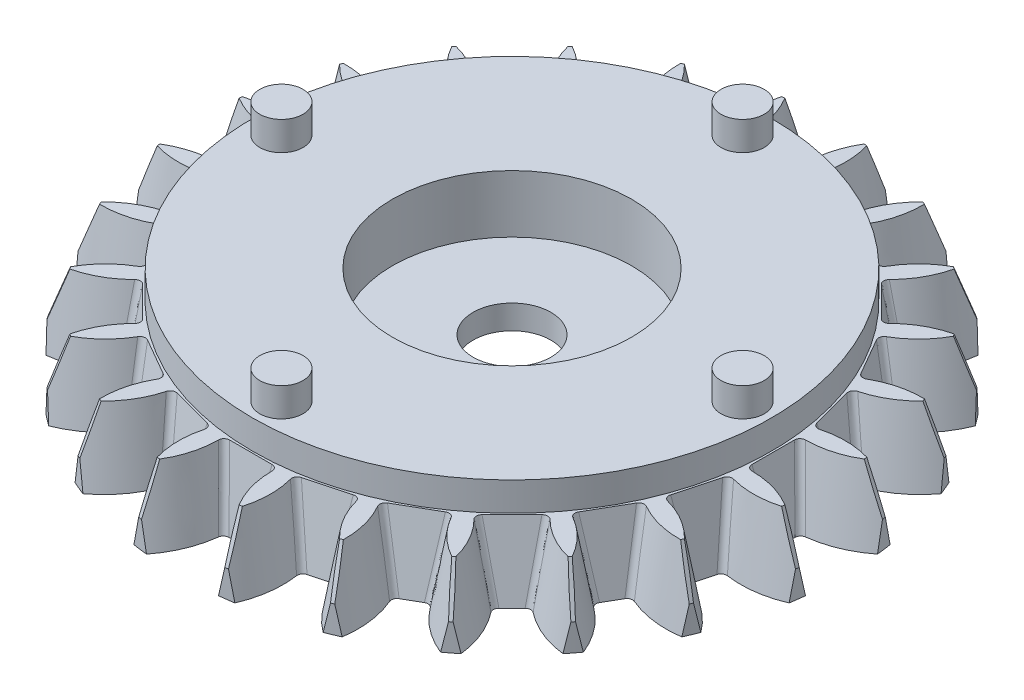
from build123d import *

# Parameters (mm, degrees)
SKETCH1_R                 = 11.5
BOSS_EXTRUDE1_DEPTH       = 2.5
SKETCH2_R                 = 9
BOSS_EXTRUDE2_DEPTH       = 1
CUT_EXTRUDE2_DEPTH        = 2.5
CUT_EXTRUDE2_DRAFT        = 10
FILLET1_R                 = 0.2
CIRPATTERN1_COPY_1_DEPTH  = 2.5
CIRPATTERN1_COPY_1_DRAFT  = 10
CIRPATTERN1_COPY_2_DEPTH  = 2.5
CIRPATTERN1_COPY_2_DRAFT  = 10
CIRPATTERN1_COPY_3_DEPTH  = 2.5
CIRPATTERN1_COPY_3_DRAFT  = 10
CIRPATTERN1_COPY_4_DEPTH  = 2.5
CIRPATTERN1_COPY_4_DRAFT  = 10
CIRPATTERN1_COPY_5_DEPTH  = 2.5
CIRPATTERN1_COPY_5_DRAFT  = 10
CIRPATTERN1_COPY_6_DEPTH  = 2.5
CIRPATTERN1_COPY_6_DRAFT  = 10
CIRPATTERN1_COPY_7_DEPTH  = 2.5
CIRPATTERN1_COPY_7_DRAFT  = 10
CIRPATTERN1_COPY_8_DEPTH  = 2.5
CIRPATTERN1_COPY_8_DRAFT  = 10
CIRPATTERN1_COPY_9_DEPTH  = 2.5
CIRPATTERN1_COPY_9_DRAFT  = 10
CIRPATTERN1_COPY_10_DEPTH = 2.5
CIRPATTERN1_COPY_10_DRAFT = 10
CIRPATTERN1_COPY_11_DEPTH = 2.5
CIRPATTERN1_COPY_11_DRAFT = 10
CIRPATTERN1_COPY_12_DEPTH = 2.5
CIRPATTERN1_COPY_12_DRAFT = 10
CIRPATTERN1_COPY_13_DEPTH = 2.5
CIRPATTERN1_COPY_13_DRAFT = 10
CIRPATTERN1_COPY_14_DEPTH = 2.5
CIRPATTERN1_COPY_14_DRAFT = 10
CIRPATTERN1_COPY_15_DEPTH = 2.5
CIRPATTERN1_COPY_15_DRAFT = 10
CIRPATTERN1_COPY_16_DEPTH = 2.5
CIRPATTERN1_COPY_16_DRAFT = 10
CIRPATTERN1_COPY_17_DEPTH = 2.5
CIRPATTERN1_COPY_17_DRAFT = 10
CIRPATTERN1_COPY_18_DEPTH = 2.5
CIRPATTERN1_COPY_18_DRAFT = 10
CIRPATTERN1_COPY_19_DEPTH = 2.5
CIRPATTERN1_COPY_19_DRAFT = 10
CIRPATTERN1_COPY_20_DEPTH = 2.5
CIRPATTERN1_COPY_20_DRAFT = 10
CIRPATTERN1_COPY_21_DEPTH = 2.5
CIRPATTERN1_COPY_21_DRAFT = 10
CIRPATTERN1_COPY_22_DEPTH = 2.5
CIRPATTERN1_COPY_22_DRAFT = 10
CIRPATTERN1_COPY_23_DEPTH = 2.5
CIRPATTERN1_COPY_23_DRAFT = 10
FILLET1_OF_CIRPATTERN1_R  = 0.2
SKETCH5_R                 = 4.15
CUT_EXTRUDE3_DEPTH        = 2
SKETCH13_R                = 0.75
BOSS_EXTRUDE3_DEPTH       = 1


with BuildPart() as part:
    # Sketch1 → Boss-Extrude1 (new body)
    with BuildSketch(Plane(origin=(0, 0, 0), x_dir=(1, 0, 0), z_dir=(0, 1, 0))):
        with Locations(Location((0, 0, 0), (0, 0, 270))):
            Circle(SKETCH1_R)
    extrude(amount=BOSS_EXTRUDE1_DEPTH)

    # Sketch2 → Boss-Extrude2 (add)
    with BuildSketch(Plane(origin=(0, 2.5, 0), x_dir=(1, 0, 0), z_dir=(0, 1, 0))):
        with Locations(Location((0, 0, 0), (0, 0, 270))):
            Circle(SKETCH2_R)
    extrude(amount=BOSS_EXTRUDE2_DEPTH)


with BuildPart() as cut_extrude2_tool:
    # Sketch4 → Cut-Extrude2 (with draft: the straight prism first)
    with BuildSketch(Plane.XZ):
        with BuildLine():
            Line((-0.5, 9.5), (0.5, 9.5))
            ThreePointArc((0.5, 9.5), (0.728740403, 10.522713492), (1.25, 11.431863365))
            ThreePointArc((1.25, 11.431863365), (0, 11.5), (-1.25, 11.431863365))
            ThreePointArc((-1.25, 11.431863365), (-0.728740403, 10.522713492), (-0.5, 9.5))
        make_face()
    extrude(amount=-CUT_EXTRUDE2_DEPTH)
    # Cut-Extrude2: the draft: its side faces are tilted about the plane it starts from
    cut_extrude2_sides = [cut_extrude2_tool.faces().sort_by_distance(p)[0] for p in [
        (-0.728740403, 1.25, 10.522713492),
        (0, 1.25, 9.5),
        (0.728740403, 1.25, 10.522713492),
        (0, 1.25, 11.5),
    ]]
    draft(cut_extrude2_sides, Plane.XZ, CUT_EXTRUDE2_DRAFT)


with BuildPart() as part_1:
    add(part.part)

    # Cut-Extrude2: cut by cut_extrude2_tool
    add(cut_extrude2_tool.part, mode=Mode.SUBTRACT)

    # Fillet1
    fillet1_edges = [part_1.edges().sort_by_distance(p)[0] for p in [
        (-0.712192573, 1.251214505, 9.279377124),
        (0.712192573, 1.251214505, 9.279377124),
    ]]
    fillet(fillet1_edges, radius=FILLET1_R)


with BuildPart() as cirpattern1_copy_1_tool:
    # CirPattern1 copy 1 sketch → CirPattern1 copy 1 (with draft: the straight prism first)
    with BuildSketch(Plane(origin=(0, 0, 0), x_dir=(0.9659258262890683, 0, 0.25881904510252074), z_dir=(0, -1, 0))):
        with BuildLine():
            Line((-0.5, 9.5), (0.5, 9.5))
            ThreePointArc((0.5, 9.5), (0.728740403, 10.522713492), (1.25, 11.431863365))
            ThreePointArc((1.25, 11.431863365), (0, 11.5), (-1.25, 11.431863365))
            ThreePointArc((-1.25, 11.431863365), (-0.728740403, 10.522713492), (-0.5, 9.5))
        make_face()
    extrude(amount=-CIRPATTERN1_COPY_1_DEPTH)
    # CirPattern1 copy 1: the draft: its side faces are tilted about the plane it starts from
    cirpattern1_copy_1_sides = [cirpattern1_copy_1_tool.faces().sort_by_distance(p)[0] for p in [
        (-3.427387834, 1.25, 9.975548829),
        (-2.458780928, 1.25, 9.17629535),
        (-2.019569482, 1.25, 10.35277262),
        (-2.976419019, 1.25, 11.108147002),
    ]]
    draft(cirpattern1_copy_1_sides, Plane(origin=(0, 0, 0), x_dir=(0.9659258262890683, 0, 0.25881904510252074), z_dir=(0, -1, 0)), CIRPATTERN1_COPY_1_DRAFT)


with BuildPart() as part_2:
    add(part_1.part)

    # CirPattern1 copy 1: cut by cirpattern1_copy_1_tool
    add(cirpattern1_copy_1_tool.part, mode=Mode.SUBTRACT)


with BuildPart() as cirpattern1_copy_2_tool:
    # CirPattern1 copy 2 sketch → CirPattern1 copy 2 (with draft: the straight prism first)
    with BuildSketch(Plane(origin=(0, 0, 0), x_dir=(0.8660254037844387, 0, 0.49999999999999994), z_dir=(0, -1, 0))):
        with BuildLine():
            Line((-0.5, 9.5), (0.5, 9.5))
            ThreePointArc((0.5, 9.5), (0.728740403, 10.522713492), (1.25, 11.431863365))
            ThreePointArc((1.25, 11.431863365), (0, 11.5), (-1.25, 11.431863365))
            ThreePointArc((-1.25, 11.431863365), (-0.728740403, 10.522713492), (-0.5, 9.5))
        make_face()
    extrude(amount=-CIRPATTERN1_COPY_2_DEPTH)
    # CirPattern1 copy 2: the draft: its side faces are tilted about the plane it starts from
    cirpattern1_copy_2_sides = [cirpattern1_copy_2_tool.faces().sort_by_distance(p)[0] for p in [
        (-5.892464448, 1.25, 8.748566999),
        (-4.75, 1.25, 8.227241336),
        (-4.630249044, 1.25, 9.477307402),
        (-5.75, 1.25, 9.959292144),
    ]]
    draft(cirpattern1_copy_2_sides, Plane(origin=(0, 0, 0), x_dir=(0.8660254037844387, 0, 0.49999999999999994), z_dir=(0, -1, 0)), CIRPATTERN1_COPY_2_DRAFT)


with BuildPart() as part_3:
    add(part_2.part)

    # CirPattern1 copy 2: cut by cirpattern1_copy_2_tool
    add(cirpattern1_copy_2_tool.part, mode=Mode.SUBTRACT)


with BuildPart() as cirpattern1_copy_3_tool:
    # CirPattern1 copy 3 sketch → CirPattern1 copy 3 (with draft: the straight prism first)
    with BuildSketch(Plane(origin=(0, 0, 0), x_dir=(0.7071067811865476, 0, 0.7071067811865475), z_dir=(0, -1, 0))):
        with BuildLine():
            Line((-0.5, 9.5), (0.5, 9.5))
            ThreePointArc((0.5, 9.5), (0.728740403, 10.522713492), (1.25, 11.431863365))
            ThreePointArc((1.25, 11.431863365), (0, 11.5), (-1.25, 11.431863365))
            ThreePointArc((-1.25, 11.431863365), (-0.728740403, 10.522713492), (-0.5, 9.5))
        make_face()
    extrude(amount=-CIRPATTERN1_COPY_3_DEPTH)
    # CirPattern1 copy 3: the draft: its side faces are tilted about the plane it starts from
    cirpattern1_copy_3_sides = [cirpattern1_copy_3_tool.faces().sort_by_distance(p)[0] for p in [
        (-7.955979347, 1.25, 6.925384786),
        (-6.717514421, 1.25, 6.717514421),
        (-6.925384786, 1.25, 7.955979347),
        (-8.131727984, 1.25, 8.131727984),
    ]]
    draft(cirpattern1_copy_3_sides, Plane(origin=(0, 0, 0), x_dir=(0.7071067811865476, 0, 0.7071067811865475), z_dir=(0, -1, 0)), CIRPATTERN1_COPY_3_DRAFT)


with BuildPart() as part_4:
    add(part_3.part)

    # CirPattern1 copy 3: cut by cirpattern1_copy_3_tool
    add(cirpattern1_copy_3_tool.part, mode=Mode.SUBTRACT)


with BuildPart() as cirpattern1_copy_4_tool:
    # CirPattern1 copy 4 sketch → CirPattern1 copy 4 (with draft: the straight prism first)
    with BuildSketch(Plane(origin=(0, 0, 0), x_dir=(0.5000000000000001, 0, 0.8660254037844386), z_dir=(0, -1, 0))):
        with BuildLine():
            Line((-0.5, 9.5), (0.5, 9.5))
            ThreePointArc((0.5, 9.5), (0.728740403, 10.522713492), (1.25, 11.431863365))
            ThreePointArc((1.25, 11.431863365), (0, 11.5), (-1.25, 11.431863365))
            ThreePointArc((-1.25, 11.431863365), (-0.728740403, 10.522713492), (-0.5, 9.5))
        make_face()
    extrude(amount=-CIRPATTERN1_COPY_4_DEPTH)
    # CirPattern1 copy 4: the draft: its side faces are tilted about the plane it starts from
    cirpattern1_copy_4_sides = [cirpattern1_copy_4_tool.faces().sort_by_distance(p)[0] for p in [
        (-9.477307402, 1.25, 4.630249044),
        (-8.227241336, 1.25, 4.75),
        (-8.748566999, 1.25, 5.892464448),
        (-9.959292144, 1.25, 5.75),
    ]]
    draft(cirpattern1_copy_4_sides, Plane(origin=(0, 0, 0), x_dir=(0.5000000000000001, 0, 0.8660254037844386), z_dir=(0, -1, 0)), CIRPATTERN1_COPY_4_DRAFT)


with BuildPart() as part_5:
    add(part_4.part)

    # CirPattern1 copy 4: cut by cirpattern1_copy_4_tool
    add(cirpattern1_copy_4_tool.part, mode=Mode.SUBTRACT)


with BuildPart() as cirpattern1_copy_5_tool:
    # CirPattern1 copy 5 sketch → CirPattern1 copy 5 (with draft: the straight prism first)
    with BuildSketch(Plane(origin=(0, 0, 0), x_dir=(0.25881904510252074, 0, 0.9659258262890683), z_dir=(0, -1, 0))):
        with BuildLine():
            Line((-0.5, 9.5), (0.5, 9.5))
            ThreePointArc((0.5, 9.5), (0.728740403, 10.522713492), (1.25, 11.431863365))
            ThreePointArc((1.25, 11.431863365), (0, 11.5), (-1.25, 11.431863365))
            ThreePointArc((-1.25, 11.431863365), (-0.728740403, 10.522713492), (-0.5, 9.5))
        make_face()
    extrude(amount=-CIRPATTERN1_COPY_5_DEPTH)
    # CirPattern1 copy 5: the draft: its side faces are tilted about the plane it starts from
    cirpattern1_copy_5_sides = [cirpattern1_copy_5_tool.faces().sort_by_distance(p)[0] for p in [
        (-10.35277262, 1.25, 2.019569482),
        (-9.17629535, 1.25, 2.458780928),
        (-9.975548829, 1.25, 3.427387834),
        (-11.108147002, 1.25, 2.976419019),
    ]]
    draft(cirpattern1_copy_5_sides, Plane(origin=(0, 0, 0), x_dir=(0.25881904510252074, 0, 0.9659258262890683), z_dir=(0, -1, 0)), CIRPATTERN1_COPY_5_DRAFT)


with BuildPart() as part_6:
    add(part_5.part)

    # CirPattern1 copy 5: cut by cirpattern1_copy_5_tool
    add(cirpattern1_copy_5_tool.part, mode=Mode.SUBTRACT)


with BuildPart() as cirpattern1_copy_6_tool:
    # CirPattern1 copy 6 sketch → CirPattern1 copy 6 (with draft: the straight prism first)
    with BuildSketch(Plane(origin=(0, 0, 0), x_dir=(0, 0, 1), z_dir=(0, -1, 0))):
        with BuildLine():
            Line((-0.5, 9.5), (0.5, 9.5))
            ThreePointArc((0.5, 9.5), (0.728740403, 10.522713492), (1.25, 11.431863365))
            ThreePointArc((1.25, 11.431863365), (0, 11.5), (-1.25, 11.431863365))
            ThreePointArc((-1.25, 11.431863365), (-0.728740403, 10.522713492), (-0.5, 9.5))
        make_face()
    extrude(amount=-CIRPATTERN1_COPY_6_DEPTH)
    # CirPattern1 copy 6: the draft: its side faces are tilted about the plane it starts from
    cirpattern1_copy_6_sides = [cirpattern1_copy_6_tool.faces().sort_by_distance(p)[0] for p in [
        (-10.522713492, 1.25, -0.728740403),
        (-9.5, 1.25, 0),
        (-10.522713492, 1.25, 0.728740403),
        (-11.5, 1.25, 0),
    ]]
    draft(cirpattern1_copy_6_sides, Plane(origin=(0, 0, 0), x_dir=(0, 0, 1), z_dir=(0, -1, 0)), CIRPATTERN1_COPY_6_DRAFT)


with BuildPart() as part_7:
    add(part_6.part)

    # CirPattern1 copy 6: cut by cirpattern1_copy_6_tool
    add(cirpattern1_copy_6_tool.part, mode=Mode.SUBTRACT)


with BuildPart() as cirpattern1_copy_7_tool:
    # CirPattern1 copy 7 sketch → CirPattern1 copy 7 (with draft: the straight prism first)
    with BuildSketch(Plane(origin=(0, 0, 0), x_dir=(-0.25881904510252085, 0, 0.9659258262890683), z_dir=(0, -1, 0))):
        with BuildLine():
            Line((-0.5, 9.5), (0.5, 9.5))
            ThreePointArc((0.5, 9.5), (0.728740403, 10.522713492), (1.25, 11.431863365))
            ThreePointArc((1.25, 11.431863365), (0, 11.5), (-1.25, 11.431863365))
            ThreePointArc((-1.25, 11.431863365), (-0.728740403, 10.522713492), (-0.5, 9.5))
        make_face()
    extrude(amount=-CIRPATTERN1_COPY_7_DEPTH)
    # CirPattern1 copy 7: the draft: its side faces are tilted about the plane it starts from
    cirpattern1_copy_7_sides = [cirpattern1_copy_7_tool.faces().sort_by_distance(p)[0] for p in [
        (-9.975548829, 1.25, -3.427387834),
        (-9.17629535, 1.25, -2.458780928),
        (-10.35277262, 1.25, -2.019569482),
        (-11.108147002, 1.25, -2.976419019),
    ]]
    draft(cirpattern1_copy_7_sides, Plane(origin=(0, 0, 0), x_dir=(-0.25881904510252085, 0, 0.9659258262890683), z_dir=(0, -1, 0)), CIRPATTERN1_COPY_7_DRAFT)


with BuildPart() as part_8:
    add(part_7.part)

    # CirPattern1 copy 7: cut by cirpattern1_copy_7_tool
    add(cirpattern1_copy_7_tool.part, mode=Mode.SUBTRACT)


with BuildPart() as cirpattern1_copy_8_tool:
    # CirPattern1 copy 8 sketch → CirPattern1 copy 8 (with draft: the straight prism first)
    with BuildSketch(Plane(origin=(0, 0, 0), x_dir=(-0.4999999999999998, 0, 0.8660254037844387), z_dir=(0, -1, 0))):
        with BuildLine():
            Line((-0.5, 9.5), (0.5, 9.5))
            ThreePointArc((0.5, 9.5), (0.728740403, 10.522713492), (1.25, 11.431863365))
            ThreePointArc((1.25, 11.431863365), (0, 11.5), (-1.25, 11.431863365))
            ThreePointArc((-1.25, 11.431863365), (-0.728740403, 10.522713492), (-0.5, 9.5))
        make_face()
    extrude(amount=-CIRPATTERN1_COPY_8_DEPTH)
    # CirPattern1 copy 8: the draft: its side faces are tilted about the plane it starts from
    cirpattern1_copy_8_sides = [cirpattern1_copy_8_tool.faces().sort_by_distance(p)[0] for p in [
        (-8.748566999, 1.25, -5.892464448),
        (-8.227241336, 1.25, -4.75),
        (-9.477307402, 1.25, -4.630249044),
        (-9.959292144, 1.25, -5.75),
    ]]
    draft(cirpattern1_copy_8_sides, Plane(origin=(0, 0, 0), x_dir=(-0.4999999999999998, 0, 0.8660254037844387), z_dir=(0, -1, 0)), CIRPATTERN1_COPY_8_DRAFT)


with BuildPart() as part_9:
    add(part_8.part)

    # CirPattern1 copy 8: cut by cirpattern1_copy_8_tool
    add(cirpattern1_copy_8_tool.part, mode=Mode.SUBTRACT)


with BuildPart() as cirpattern1_copy_9_tool:
    # CirPattern1 copy 9 sketch → CirPattern1 copy 9 (with draft: the straight prism first)
    with BuildSketch(Plane(origin=(0, 0, 0), x_dir=(-0.7071067811865475, 0, 0.7071067811865476), z_dir=(0, -1, 0))):
        with BuildLine():
            Line((-0.5, 9.5), (0.5, 9.5))
            ThreePointArc((0.5, 9.5), (0.728740403, 10.522713492), (1.25, 11.431863365))
            ThreePointArc((1.25, 11.431863365), (0, 11.5), (-1.25, 11.431863365))
            ThreePointArc((-1.25, 11.431863365), (-0.728740403, 10.522713492), (-0.5, 9.5))
        make_face()
    extrude(amount=-CIRPATTERN1_COPY_9_DEPTH)
    # CirPattern1 copy 9: the draft: its side faces are tilted about the plane it starts from
    cirpattern1_copy_9_sides = [cirpattern1_copy_9_tool.faces().sort_by_distance(p)[0] for p in [
        (-6.925384786, 1.25, -7.955979347),
        (-6.717514421, 1.25, -6.717514421),
        (-7.955979347, 1.25, -6.925384786),
        (-8.131727984, 1.25, -8.131727984),
    ]]
    draft(cirpattern1_copy_9_sides, Plane(origin=(0, 0, 0), x_dir=(-0.7071067811865475, 0, 0.7071067811865476), z_dir=(0, -1, 0)), CIRPATTERN1_COPY_9_DRAFT)


with BuildPart() as part_10:
    add(part_9.part)

    # CirPattern1 copy 9: cut by cirpattern1_copy_9_tool
    add(cirpattern1_copy_9_tool.part, mode=Mode.SUBTRACT)


with BuildPart() as cirpattern1_copy_10_tool:
    # CirPattern1 copy 10 sketch → CirPattern1 copy 10 (with draft: the straight prism first)
    with BuildSketch(Plane(origin=(0, 0, 0), x_dir=(-0.8660254037844387, 0, 0.49999999999999994), z_dir=(0, -1, 0))):
        with BuildLine():
            Line((-0.5, 9.5), (0.5, 9.5))
            ThreePointArc((0.5, 9.5), (0.728740403, 10.522713492), (1.25, 11.431863365))
            ThreePointArc((1.25, 11.431863365), (0, 11.5), (-1.25, 11.431863365))
            ThreePointArc((-1.25, 11.431863365), (-0.728740403, 10.522713492), (-0.5, 9.5))
        make_face()
    extrude(amount=-CIRPATTERN1_COPY_10_DEPTH)
    # CirPattern1 copy 10: the draft: its side faces are tilted about the plane it starts from
    cirpattern1_copy_10_sides = [cirpattern1_copy_10_tool.faces().sort_by_distance(p)[0] for p in [
        (-4.630249044, 1.25, -9.477307402),
        (-4.75, 1.25, -8.227241336),
        (-5.892464448, 1.25, -8.748566999),
        (-5.75, 1.25, -9.959292144),
    ]]
    draft(cirpattern1_copy_10_sides, Plane(origin=(0, 0, 0), x_dir=(-0.8660254037844387, 0, 0.49999999999999994), z_dir=(0, -1, 0)), CIRPATTERN1_COPY_10_DRAFT)


with BuildPart() as part_11:
    add(part_10.part)

    # CirPattern1 copy 10: cut by cirpattern1_copy_10_tool
    add(cirpattern1_copy_10_tool.part, mode=Mode.SUBTRACT)


with BuildPart() as cirpattern1_copy_11_tool:
    # CirPattern1 copy 11 sketch → CirPattern1 copy 11 (with draft: the straight prism first)
    with BuildSketch(Plane(origin=(0, 0, 0), x_dir=(-0.9659258262890682, 0, 0.258819045102521), z_dir=(0, -1, 0))):
        with BuildLine():
            Line((-0.5, 9.5), (0.5, 9.5))
            ThreePointArc((0.5, 9.5), (0.728740403, 10.522713492), (1.25, 11.431863365))
            ThreePointArc((1.25, 11.431863365), (0, 11.5), (-1.25, 11.431863365))
            ThreePointArc((-1.25, 11.431863365), (-0.728740403, 10.522713492), (-0.5, 9.5))
        make_face()
    extrude(amount=-CIRPATTERN1_COPY_11_DEPTH)
    # CirPattern1 copy 11: the draft: its side faces are tilted about the plane it starts from
    cirpattern1_copy_11_sides = [cirpattern1_copy_11_tool.faces().sort_by_distance(p)[0] for p in [
        (-2.019569482, 1.25, -10.35277262),
        (-2.458780928, 1.25, -9.17629535),
        (-3.427387834, 1.25, -9.975548829),
        (-2.976419019, 1.25, -11.108147002),
    ]]
    draft(cirpattern1_copy_11_sides, Plane(origin=(0, 0, 0), x_dir=(-0.9659258262890682, 0, 0.258819045102521), z_dir=(0, -1, 0)), CIRPATTERN1_COPY_11_DRAFT)


with BuildPart() as part_12:
    add(part_11.part)

    # CirPattern1 copy 11: cut by cirpattern1_copy_11_tool
    add(cirpattern1_copy_11_tool.part, mode=Mode.SUBTRACT)


with BuildPart() as cirpattern1_copy_12_tool:
    # CirPattern1 copy 12 sketch → CirPattern1 copy 12 (with draft: the straight prism first)
    with BuildSketch(Plane(origin=(0, 0, 0), x_dir=(-1, 0, 0), z_dir=(0, -1, 0))):
        with BuildLine():
            Line((-0.5, 9.5), (0.5, 9.5))
            ThreePointArc((0.5, 9.5), (0.728740403, 10.522713492), (1.25, 11.431863365))
            ThreePointArc((1.25, 11.431863365), (0, 11.5), (-1.25, 11.431863365))
            ThreePointArc((-1.25, 11.431863365), (-0.728740403, 10.522713492), (-0.5, 9.5))
        make_face()
    extrude(amount=-CIRPATTERN1_COPY_12_DEPTH)
    # CirPattern1 copy 12: the draft: its side faces are tilted about the plane it starts from
    cirpattern1_copy_12_sides = [cirpattern1_copy_12_tool.faces().sort_by_distance(p)[0] for p in [
        (0.728740403, 1.25, -10.522713492),
        (0, 1.25, -9.5),
        (-0.728740403, 1.25, -10.522713492),
        (0, 1.25, -11.5),
    ]]
    draft(cirpattern1_copy_12_sides, Plane(origin=(0, 0, 0), x_dir=(-1, 0, 0), z_dir=(0, -1, 0)), CIRPATTERN1_COPY_12_DRAFT)


with BuildPart() as part_13:
    add(part_12.part)

    # CirPattern1 copy 12: cut by cirpattern1_copy_12_tool
    add(cirpattern1_copy_12_tool.part, mode=Mode.SUBTRACT)


with BuildPart() as cirpattern1_copy_13_tool:
    # CirPattern1 copy 13 sketch → CirPattern1 copy 13 (with draft: the straight prism first)
    with BuildSketch(Plane(origin=(0, 0, 0), x_dir=(-0.9659258262890683, 0, -0.2588190451025208), z_dir=(0, -1, 0))):
        with BuildLine():
            Line((-0.5, 9.5), (0.5, 9.5))
            ThreePointArc((0.5, 9.5), (0.728740403, 10.522713492), (1.25, 11.431863365))
            ThreePointArc((1.25, 11.431863365), (0, 11.5), (-1.25, 11.431863365))
            ThreePointArc((-1.25, 11.431863365), (-0.728740403, 10.522713492), (-0.5, 9.5))
        make_face()
    extrude(amount=-CIRPATTERN1_COPY_13_DEPTH)
    # CirPattern1 copy 13: the draft: its side faces are tilted about the plane it starts from
    cirpattern1_copy_13_sides = [cirpattern1_copy_13_tool.faces().sort_by_distance(p)[0] for p in [
        (3.427387834, 1.25, -9.975548829),
        (2.458780928, 1.25, -9.17629535),
        (2.019569482, 1.25, -10.35277262),
        (2.976419019, 1.25, -11.108147002),
    ]]
    draft(cirpattern1_copy_13_sides, Plane(origin=(0, 0, 0), x_dir=(-0.9659258262890683, 0, -0.2588190451025208), z_dir=(0, -1, 0)), CIRPATTERN1_COPY_13_DRAFT)


with BuildPart() as part_14:
    add(part_13.part)

    # CirPattern1 copy 13: cut by cirpattern1_copy_13_tool
    add(cirpattern1_copy_13_tool.part, mode=Mode.SUBTRACT)


with BuildPart() as cirpattern1_copy_14_tool:
    # CirPattern1 copy 14 sketch → CirPattern1 copy 14 (with draft: the straight prism first)
    with BuildSketch(Plane(origin=(0, 0, 0), x_dir=(-0.8660254037844386, 0, -0.5000000000000001), z_dir=(0, -1, 0))):
        with BuildLine():
            Line((-0.5, 9.5), (0.5, 9.5))
            ThreePointArc((0.5, 9.5), (0.728740403, 10.522713492), (1.25, 11.431863365))
            ThreePointArc((1.25, 11.431863365), (0, 11.5), (-1.25, 11.431863365))
            ThreePointArc((-1.25, 11.431863365), (-0.728740403, 10.522713492), (-0.5, 9.5))
        make_face()
    extrude(amount=-CIRPATTERN1_COPY_14_DEPTH)
    # CirPattern1 copy 14: the draft: its side faces are tilted about the plane it starts from
    cirpattern1_copy_14_sides = [cirpattern1_copy_14_tool.faces().sort_by_distance(p)[0] for p in [
        (5.892464448, 1.25, -8.748566999),
        (4.75, 1.25, -8.227241336),
        (4.630249044, 1.25, -9.477307402),
        (5.75, 1.25, -9.959292144),
    ]]
    draft(cirpattern1_copy_14_sides, Plane(origin=(0, 0, 0), x_dir=(-0.8660254037844386, 0, -0.5000000000000001), z_dir=(0, -1, 0)), CIRPATTERN1_COPY_14_DRAFT)


with BuildPart() as part_15:
    add(part_14.part)

    # CirPattern1 copy 14: cut by cirpattern1_copy_14_tool
    add(cirpattern1_copy_14_tool.part, mode=Mode.SUBTRACT)


with BuildPart() as cirpattern1_copy_15_tool:
    # CirPattern1 copy 15 sketch → CirPattern1 copy 15 (with draft: the straight prism first)
    with BuildSketch(Plane(origin=(0, 0, 0), x_dir=(-0.7071067811865477, 0, -0.7071067811865475), z_dir=(0, -1, 0))):
        with BuildLine():
            Line((-0.5, 9.5), (0.5, 9.5))
            ThreePointArc((0.5, 9.5), (0.728740403, 10.522713492), (1.25, 11.431863365))
            ThreePointArc((1.25, 11.431863365), (0, 11.5), (-1.25, 11.431863365))
            ThreePointArc((-1.25, 11.431863365), (-0.728740403, 10.522713492), (-0.5, 9.5))
        make_face()
    extrude(amount=-CIRPATTERN1_COPY_15_DEPTH)
    # CirPattern1 copy 15: the draft: its side faces are tilted about the plane it starts from
    cirpattern1_copy_15_sides = [cirpattern1_copy_15_tool.faces().sort_by_distance(p)[0] for p in [
        (7.955979347, 1.25, -6.925384786),
        (6.717514421, 1.25, -6.717514421),
        (6.925384786, 1.25, -7.955979347),
        (8.131727984, 1.25, -8.131727984),
    ]]
    draft(cirpattern1_copy_15_sides, Plane(origin=(0, 0, 0), x_dir=(-0.7071067811865477, 0, -0.7071067811865475), z_dir=(0, -1, 0)), CIRPATTERN1_COPY_15_DRAFT)


with BuildPart() as part_16:
    add(part_15.part)

    # CirPattern1 copy 15: cut by cirpattern1_copy_15_tool
    add(cirpattern1_copy_15_tool.part, mode=Mode.SUBTRACT)


with BuildPart() as cirpattern1_copy_16_tool:
    # CirPattern1 copy 16 sketch → CirPattern1 copy 16 (with draft: the straight prism first)
    with BuildSketch(Plane(origin=(0, 0, 0), x_dir=(-0.5000000000000004, 0, -0.8660254037844384), z_dir=(0, -1, 0))):
        with BuildLine():
            Line((-0.5, 9.5), (0.5, 9.5))
            ThreePointArc((0.5, 9.5), (0.728740403, 10.522713492), (1.25, 11.431863365))
            ThreePointArc((1.25, 11.431863365), (0, 11.5), (-1.25, 11.431863365))
            ThreePointArc((-1.25, 11.431863365), (-0.728740403, 10.522713492), (-0.5, 9.5))
        make_face()
    extrude(amount=-CIRPATTERN1_COPY_16_DEPTH)
    # CirPattern1 copy 16: the draft: its side faces are tilted about the plane it starts from
    cirpattern1_copy_16_sides = [cirpattern1_copy_16_tool.faces().sort_by_distance(p)[0] for p in [
        (9.477307402, 1.25, -4.630249044),
        (8.227241336, 1.25, -4.75),
        (8.748566999, 1.25, -5.892464448),
        (9.959292144, 1.25, -5.75),
    ]]
    draft(cirpattern1_copy_16_sides, Plane(origin=(0, 0, 0), x_dir=(-0.5000000000000004, 0, -0.8660254037844384), z_dir=(0, -1, 0)), CIRPATTERN1_COPY_16_DRAFT)


with BuildPart() as part_17:
    add(part_16.part)

    # CirPattern1 copy 16: cut by cirpattern1_copy_16_tool
    add(cirpattern1_copy_16_tool.part, mode=Mode.SUBTRACT)


with BuildPart() as cirpattern1_copy_17_tool:
    # CirPattern1 copy 17 sketch → CirPattern1 copy 17 (with draft: the straight prism first)
    with BuildSketch(Plane(origin=(0, 0, 0), x_dir=(-0.25881904510252063, 0, -0.9659258262890683), z_dir=(0, -1, 0))):
        with BuildLine():
            Line((-0.5, 9.5), (0.5, 9.5))
            ThreePointArc((0.5, 9.5), (0.728740403, 10.522713492), (1.25, 11.431863365))
            ThreePointArc((1.25, 11.431863365), (0, 11.5), (-1.25, 11.431863365))
            ThreePointArc((-1.25, 11.431863365), (-0.728740403, 10.522713492), (-0.5, 9.5))
        make_face()
    extrude(amount=-CIRPATTERN1_COPY_17_DEPTH)
    # CirPattern1 copy 17: the draft: its side faces are tilted about the plane it starts from
    cirpattern1_copy_17_sides = [cirpattern1_copy_17_tool.faces().sort_by_distance(p)[0] for p in [
        (10.35277262, 1.25, -2.019569482),
        (9.17629535, 1.25, -2.458780928),
        (9.975548829, 1.25, -3.427387834),
        (11.108147002, 1.25, -2.976419019),
    ]]
    draft(cirpattern1_copy_17_sides, Plane(origin=(0, 0, 0), x_dir=(-0.25881904510252063, 0, -0.9659258262890683), z_dir=(0, -1, 0)), CIRPATTERN1_COPY_17_DRAFT)


with BuildPart() as part_18:
    add(part_17.part)

    # CirPattern1 copy 17: cut by cirpattern1_copy_17_tool
    add(cirpattern1_copy_17_tool.part, mode=Mode.SUBTRACT)


with BuildPart() as cirpattern1_copy_18_tool:
    # CirPattern1 copy 18 sketch → CirPattern1 copy 18 (with draft: the straight prism first)
    with BuildSketch(Plane(origin=(0, 0, 0), x_dir=(0, 0, -1), z_dir=(0, -1, 0))):
        with BuildLine():
            Line((-0.5, 9.5), (0.5, 9.5))
            ThreePointArc((0.5, 9.5), (0.728740403, 10.522713492), (1.25, 11.431863365))
            ThreePointArc((1.25, 11.431863365), (0, 11.5), (-1.25, 11.431863365))
            ThreePointArc((-1.25, 11.431863365), (-0.728740403, 10.522713492), (-0.5, 9.5))
        make_face()
    extrude(amount=-CIRPATTERN1_COPY_18_DEPTH)
    # CirPattern1 copy 18: the draft: its side faces are tilted about the plane it starts from
    cirpattern1_copy_18_sides = [cirpattern1_copy_18_tool.faces().sort_by_distance(p)[0] for p in [
        (10.522713492, 1.25, 0.728740403),
        (9.5, 1.25, 0),
        (10.522713492, 1.25, -0.728740403),
        (11.5, 1.25, 0),
    ]]
    draft(cirpattern1_copy_18_sides, Plane(origin=(0, 0, 0), x_dir=(0, 0, -1), z_dir=(0, -1, 0)), CIRPATTERN1_COPY_18_DRAFT)


with BuildPart() as part_19:
    add(part_18.part)

    # CirPattern1 copy 18: cut by cirpattern1_copy_18_tool
    add(cirpattern1_copy_18_tool.part, mode=Mode.SUBTRACT)


with BuildPart() as cirpattern1_copy_19_tool:
    # CirPattern1 copy 19 sketch → CirPattern1 copy 19 (with draft: the straight prism first)
    with BuildSketch(Plane(origin=(0, 0, 0), x_dir=(0.2588190451025203, 0, -0.9659258262890684), z_dir=(0, -1, 0))):
        with BuildLine():
            Line((-0.5, 9.5), (0.5, 9.5))
            ThreePointArc((0.5, 9.5), (0.728740403, 10.522713492), (1.25, 11.431863365))
            ThreePointArc((1.25, 11.431863365), (0, 11.5), (-1.25, 11.431863365))
            ThreePointArc((-1.25, 11.431863365), (-0.728740403, 10.522713492), (-0.5, 9.5))
        make_face()
    extrude(amount=-CIRPATTERN1_COPY_19_DEPTH)
    # CirPattern1 copy 19: the draft: its side faces are tilted about the plane it starts from
    cirpattern1_copy_19_sides = [cirpattern1_copy_19_tool.faces().sort_by_distance(p)[0] for p in [
        (9.975548829, 1.25, 3.427387834),
        (9.17629535, 1.25, 2.458780928),
        (10.35277262, 1.25, 2.019569482),
        (11.108147002, 1.25, 2.976419019),
    ]]
    draft(cirpattern1_copy_19_sides, Plane(origin=(0, 0, 0), x_dir=(0.2588190451025203, 0, -0.9659258262890684), z_dir=(0, -1, 0)), CIRPATTERN1_COPY_19_DRAFT)


with BuildPart() as part_20:
    add(part_19.part)

    # CirPattern1 copy 19: cut by cirpattern1_copy_19_tool
    add(cirpattern1_copy_19_tool.part, mode=Mode.SUBTRACT)


with BuildPart() as cirpattern1_copy_20_tool:
    # CirPattern1 copy 20 sketch → CirPattern1 copy 20 (with draft: the straight prism first)
    with BuildSketch(Plane(origin=(0, 0, 0), x_dir=(0.5000000000000001, 0, -0.8660254037844386), z_dir=(0, -1, 0))):
        with BuildLine():
            Line((-0.5, 9.5), (0.5, 9.5))
            ThreePointArc((0.5, 9.5), (0.728740403, 10.522713492), (1.25, 11.431863365))
            ThreePointArc((1.25, 11.431863365), (0, 11.5), (-1.25, 11.431863365))
            ThreePointArc((-1.25, 11.431863365), (-0.728740403, 10.522713492), (-0.5, 9.5))
        make_face()
    extrude(amount=-CIRPATTERN1_COPY_20_DEPTH)
    # CirPattern1 copy 20: the draft: its side faces are tilted about the plane it starts from
    cirpattern1_copy_20_sides = [cirpattern1_copy_20_tool.faces().sort_by_distance(p)[0] for p in [
        (8.748566999, 1.25, 5.892464448),
        (8.227241336, 1.25, 4.75),
        (9.477307402, 1.25, 4.630249044),
        (9.959292144, 1.25, 5.75),
    ]]
    draft(cirpattern1_copy_20_sides, Plane(origin=(0, 0, 0), x_dir=(0.5000000000000001, 0, -0.8660254037844386), z_dir=(0, -1, 0)), CIRPATTERN1_COPY_20_DRAFT)


with BuildPart() as part_21:
    add(part_20.part)

    # CirPattern1 copy 20: cut by cirpattern1_copy_20_tool
    add(cirpattern1_copy_20_tool.part, mode=Mode.SUBTRACT)


with BuildPart() as cirpattern1_copy_21_tool:
    # CirPattern1 copy 21 sketch → CirPattern1 copy 21 (with draft: the straight prism first)
    with BuildSketch(Plane(origin=(0, 0, 0), x_dir=(0.7071067811865474, 0, -0.7071067811865477), z_dir=(0, -1, 0))):
        with BuildLine():
            Line((-0.5, 9.5), (0.5, 9.5))
            ThreePointArc((0.5, 9.5), (0.728740403, 10.522713492), (1.25, 11.431863365))
            ThreePointArc((1.25, 11.431863365), (0, 11.5), (-1.25, 11.431863365))
            ThreePointArc((-1.25, 11.431863365), (-0.728740403, 10.522713492), (-0.5, 9.5))
        make_face()
    extrude(amount=-CIRPATTERN1_COPY_21_DEPTH)
    # CirPattern1 copy 21: the draft: its side faces are tilted about the plane it starts from
    cirpattern1_copy_21_sides = [cirpattern1_copy_21_tool.faces().sort_by_distance(p)[0] for p in [
        (6.925384786, 1.25, 7.955979347),
        (6.717514421, 1.25, 6.717514421),
        (7.955979347, 1.25, 6.925384786),
        (8.131727984, 1.25, 8.131727984),
    ]]
    draft(cirpattern1_copy_21_sides, Plane(origin=(0, 0, 0), x_dir=(0.7071067811865474, 0, -0.7071067811865477), z_dir=(0, -1, 0)), CIRPATTERN1_COPY_21_DRAFT)


with BuildPart() as part_22:
    add(part_21.part)

    # CirPattern1 copy 21: cut by cirpattern1_copy_21_tool
    add(cirpattern1_copy_21_tool.part, mode=Mode.SUBTRACT)


with BuildPart() as cirpattern1_copy_22_tool:
    # CirPattern1 copy 22 sketch → CirPattern1 copy 22 (with draft: the straight prism first)
    with BuildSketch(Plane(origin=(0, 0, 0), x_dir=(0.8660254037844384, 0, -0.5000000000000004), z_dir=(0, -1, 0))):
        with BuildLine():
            Line((-0.5, 9.5), (0.5, 9.5))
            ThreePointArc((0.5, 9.5), (0.728740403, 10.522713492), (1.25, 11.431863365))
            ThreePointArc((1.25, 11.431863365), (0, 11.5), (-1.25, 11.431863365))
            ThreePointArc((-1.25, 11.431863365), (-0.728740403, 10.522713492), (-0.5, 9.5))
        make_face()
    extrude(amount=-CIRPATTERN1_COPY_22_DEPTH)
    # CirPattern1 copy 22: the draft: its side faces are tilted about the plane it starts from
    cirpattern1_copy_22_sides = [cirpattern1_copy_22_tool.faces().sort_by_distance(p)[0] for p in [
        (4.630249044, 1.25, 9.477307402),
        (4.75, 1.25, 8.227241336),
        (5.892464448, 1.25, 8.748566999),
        (5.75, 1.25, 9.959292144),
    ]]
    draft(cirpattern1_copy_22_sides, Plane(origin=(0, 0, 0), x_dir=(0.8660254037844384, 0, -0.5000000000000004), z_dir=(0, -1, 0)), CIRPATTERN1_COPY_22_DRAFT)


with BuildPart() as part_23:
    add(part_22.part)

    # CirPattern1 copy 22: cut by cirpattern1_copy_22_tool
    add(cirpattern1_copy_22_tool.part, mode=Mode.SUBTRACT)


with BuildPart() as cirpattern1_copy_23_tool:
    # CirPattern1 copy 23 sketch → CirPattern1 copy 23 (with draft: the straight prism first)
    with BuildSketch(Plane(origin=(0, 0, 0), x_dir=(0.9659258262890683, 0, -0.2588190451025207), z_dir=(0, -1, 0))):
        with BuildLine():
            Line((-0.5, 9.5), (0.5, 9.5))
            ThreePointArc((0.5, 9.5), (0.728740403, 10.522713492), (1.25, 11.431863365))
            ThreePointArc((1.25, 11.431863365), (0, 11.5), (-1.25, 11.431863365))
            ThreePointArc((-1.25, 11.431863365), (-0.728740403, 10.522713492), (-0.5, 9.5))
        make_face()
    extrude(amount=-CIRPATTERN1_COPY_23_DEPTH)
    # CirPattern1 copy 23: the draft: its side faces are tilted about the plane it starts from
    cirpattern1_copy_23_sides = [cirpattern1_copy_23_tool.faces().sort_by_distance(p)[0] for p in [
        (2.019569482, 1.25, 10.35277262),
        (2.458780928, 1.25, 9.17629535),
        (3.427387834, 1.25, 9.975548829),
        (2.976419019, 1.25, 11.108147002),
    ]]
    draft(cirpattern1_copy_23_sides, Plane(origin=(0, 0, 0), x_dir=(0.9659258262890683, 0, -0.2588190451025207), z_dir=(0, -1, 0)), CIRPATTERN1_COPY_23_DRAFT)


with BuildPart() as part_24:
    add(part_23.part)

    # CirPattern1 copy 23: cut by cirpattern1_copy_23_tool
    add(cirpattern1_copy_23_tool.part, mode=Mode.SUBTRACT)

    # Fillet1 of CirPattern1
    fillet1_of_cirpattern1_edges = [part_24.edges().sort_by_distance(p)[0] for p in [
        (-3.089604726, 1.251214505, 8.778861014),
        (-1.713754327, 1.251214505, 9.147519018),
        (-5.256465423, 1.251214505, 7.680080034),
        (-4.022911701, 1.251214505, 8.392272607),
        (-7.065106688, 1.251214505, 6.057914292),
        (-6.057914292, 1.251214505, 7.065106688),
        (-8.392272607, 1.251214505, 4.022911701),
        (-7.680080034, 1.251214505, 5.256465423),
        (-9.147519018, 1.251214505, 1.713754327),
        (-8.778861014, 1.251214505, 3.089604726),
        (-9.279377124, 1.251214505, -0.712192573),
        (-9.279377124, 1.251214505, 0.712192573),
        (-8.778861014, 1.251214505, -3.089604726),
        (-9.147519018, 1.251214505, -1.713754327),
        (-7.680080034, 1.251214505, -5.256465423),
        (-8.392272607, 1.251214505, -4.022911701),
        (-6.057914292, 1.251214505, -7.065106688),
        (-7.065106688, 1.251214505, -6.057914292),
        (-4.022911701, 1.251214505, -8.392272607),
        (-5.256465423, 1.251214505, -7.680080034),
        (-1.713754327, 1.251214505, -9.147519018),
        (-3.089604726, 1.251214505, -8.778861014),
        (0.712192573, 1.251214505, -9.279377124),
        (-0.712192573, 1.251214505, -9.279377124),
        (3.089604726, 1.251214505, -8.778861014),
        (1.713754327, 1.251214505, -9.147519018),
        (5.256465423, 1.251214505, -7.680080034),
        (4.022911701, 1.251214505, -8.392272607),
        (7.065106688, 1.251214505, -6.057914292),
        (6.057914292, 1.251214505, -7.065106688),
        (8.392272607, 1.251214505, -4.022911701),
        (7.680080034, 1.251214505, -5.256465423),
        (9.147519018, 1.251214505, -1.713754327),
        (8.778861014, 1.251214505, -3.089604726),
        (9.279377124, 1.251214505, 0.712192573),
        (9.279377124, 1.251214505, -0.712192573),
        (8.778861014, 1.251214505, 3.089604726),
        (9.147519018, 1.251214505, 1.713754327),
        (7.680080034, 1.251214505, 5.256465423),
        (8.392272607, 1.251214505, 4.022911701),
        (6.057914292, 1.251214505, 7.065106688),
        (7.065106688, 1.251214505, 6.057914292),
        (4.022911701, 1.251214505, 8.392272607),
        (5.256465423, 1.251214505, 7.680080034),
        (1.713754327, 1.251214505, 9.147519018),
        (3.089604726, 1.251214505, 8.778861014),
    ]]
    fillet(fillet1_of_cirpattern1_edges, radius=FILLET1_OF_CIRPATTERN1_R)

    # Sketch5 → Cut-Extrude3 (cut)
    with BuildSketch(Plane(origin=(0, 3.5, 0), x_dir=(1, 0, 0), z_dir=(0, 1, 0))):
        with Locations(Location((0, 0, 0), (0, 0, 270))):
            Circle(SKETCH5_R)
    extrude(amount=-CUT_EXTRUDE3_DEPTH, mode=Mode.SUBTRACT)

    # Sketch9 → Cut-Revolve1 (revolve, cut)
    with BuildSketch(Plane(origin=(0, 0, 0), x_dir=(0, 0, -1), z_dir=(1, 0, 0))):
        Polygon((10.931066973, 2.5), (11.75, 2.5), (11.75, 0.25), align=None)
    revolve(axis=Axis((0, 0, 0), (0, 1, 0)), mode=Mode.SUBTRACT)

    # Sketch12 → Cut-Revolve3 (revolve, cut)
    with BuildSketch(Plane.XY, mode=Mode.PRIVATE) as cut_revolve3_sk:
        Polygon((0, 0), (0, 3.5), (1.35, 3.5), (1.35, 0.66395281), (2.5, 0), align=None)
    revolve(cut_revolve3_sk.sketch.rotate(Axis((0, 0, 0), (0, 1, 0)), 90), axis=Axis((0, 0, 0), (0, 1, 0)), mode=Mode.SUBTRACT)

    # Sketch13 → Boss-Extrude3 (add)
    with BuildSketch(Plane(origin=(0, 3.5, 0), x_dir=(1, 0, 0), z_dir=(0, 1, 0))):
        with Locations(Location((0, 8, 0), (0, 0, 270))):
            Circle(SKETCH13_R)
        with Locations(Location((8, 0, 0), (0, 0, 270))):
            Circle(SKETCH13_R)
        with Locations(Location((0, -8, 0), (0, 0, 270))):
            Circle(SKETCH13_R)
        with Locations(Location((-8, 0, 0), (0, 0, 270))):
            Circle(SKETCH13_R)
    extrude(amount=BOSS_EXTRUDE3_DEPTH)


solid = part_24.part
